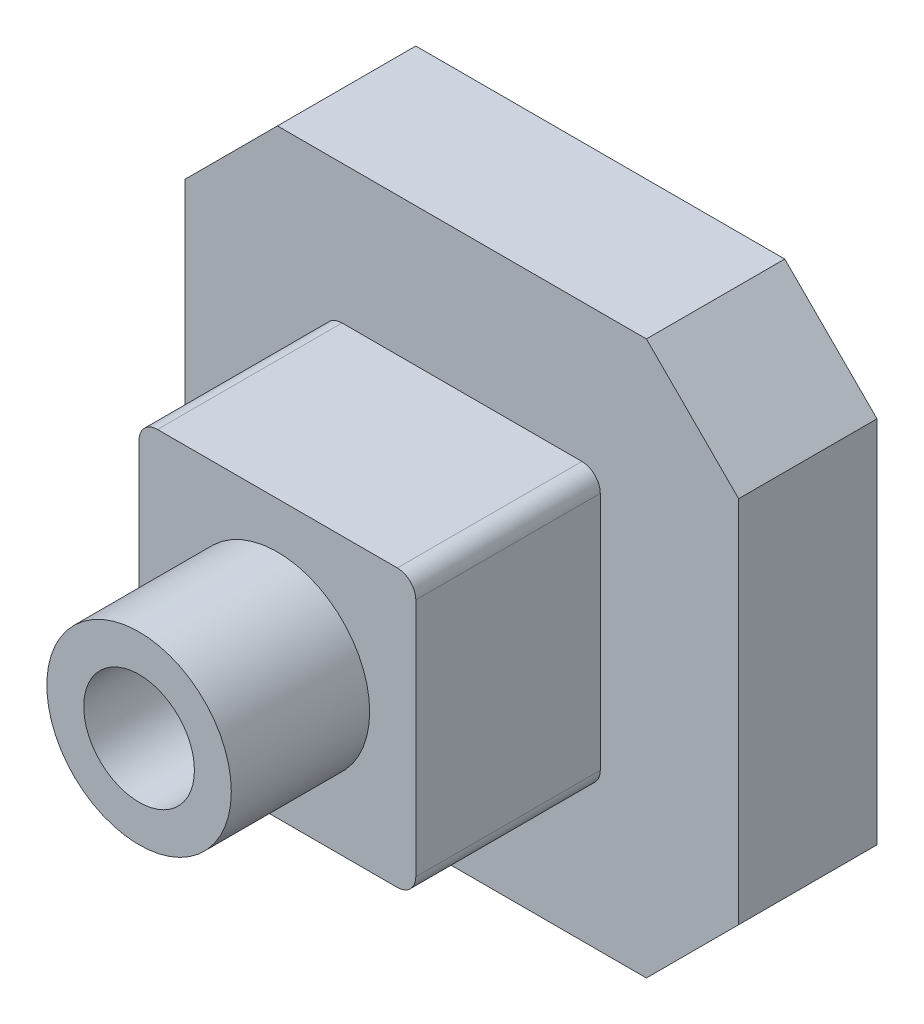
from build123d import *

# Parameters (mm, degrees)
SKETCH1_W           = 60
SKETCH1_H           = 60
BOSS_EXTRUDE1_DEPTH = 15
SKETCH2_W           = 30
SKETCH2_H           = 30
BOSS_EXTRUDE2_DEPTH = 20
SKETCH3_R           = 10
BOSS_EXTRUDE3_DEPTH = 15
SKETCH4_R           = 6
CUT_EXTRUDE1_DEPTH  = 66.574385243
CHAMFER1_SIZE       = 10
FILLET1_R           = 2
SHELL1_T            = -3


with BuildPart() as part:
    # Sketch1 → Boss-Extrude1 (new body)
    with BuildSketch(Plane.XY):
        Rectangle(SKETCH1_W, SKETCH1_H)
    extrude(amount=BOSS_EXTRUDE1_DEPTH)

    # Sketch2 → Boss-Extrude2 (add)
    with BuildSketch(Plane.XY.offset(15)):
        Rectangle(SKETCH2_W, SKETCH2_H)
    extrude(amount=BOSS_EXTRUDE2_DEPTH)

    # Sketch3 → Boss-Extrude3 (add)
    with BuildSketch(Plane.XY.offset(35)):
        Circle(SKETCH3_R)
    extrude(amount=BOSS_EXTRUDE3_DEPTH)

    # Sketch4 → Cut-Extrude1 (cut, through all)
    with BuildSketch(Plane.XY.offset(50)):
        Circle(SKETCH4_R)
    extrude(amount=-CUT_EXTRUDE1_DEPTH, mode=Mode.SUBTRACT)

    # Chamfer1
    chamfer1_edges = [part.edges().sort_by_distance(p)[0] for p in [
        (30, 30, 7.5),
        (30, -30, 7.5),
        (-30, -30, 7.5),
        (-30, 30, 7.5),
    ]]
    chamfer(chamfer1_edges, length=CHAMFER1_SIZE)

    # Fillet1
    fillet1_edges = [part.edges().sort_by_distance(p)[0] for p in [
        (15, -15, 25),
        (15, 15, 25),
        (-15, 15, 25),
        (-15, -15, 25),
    ]]
    fillet(fillet1_edges, radius=FILLET1_R)

    # Shell1
    shell1_openings = [part.faces().sort_by_distance(p)[0] for p in [
        (0, 29.151471863, 0),
    ]]
    offset(amount=SHELL1_T, openings=shell1_openings, kind=Kind.INTERSECTION)


solid = part.part
